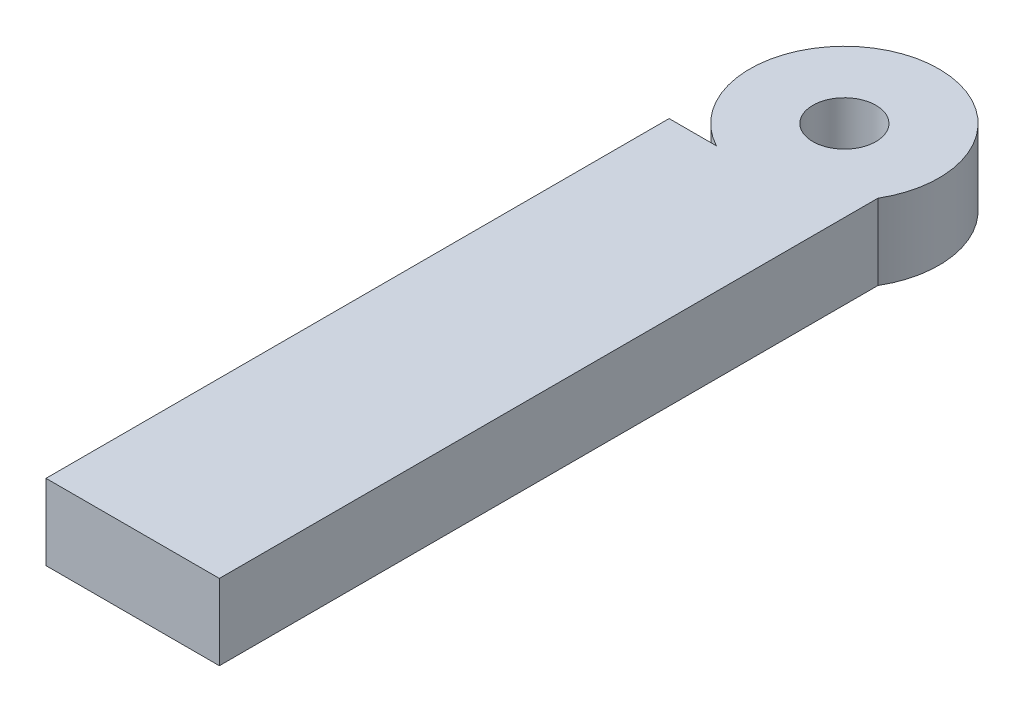
from build123d import *

# Parameters (mm, degrees)
SKETCH1_R           = 3.175
BOSS_EXTRUDE1_DEPTH = 7.62
SKETCH2_R           = 2.54
CUT_EXTRUDE1_DEPTH  = 6.35
BOSS_EXTRUDE3_START = 4.7625
SKETCH4_W           = 62.764867648
SKETCH4_H           = 7.62
SKETCH4_R           = 2.54
BOSS_EXTRUDE3_DEPTH = 4.7625


with BuildPart() as part:
    # Sketch1 → Boss-Extrude1 (new body)
    with BuildSketch(Plane(origin=(0, 0, 0), x_dir=(1, 0, 0), z_dir=(0, 1, 0))):
        with BuildLine():
            Line((-4.490128061, -8.400260413), (-4.490128061, -71.165128061))
            Line((-4.490128061, -71.165128061), (8.209871939, -71.165128061))
            Line((8.209871939, -71.165128061), (8.209871939, -4.829454186))
            ThreePointArc((8.209871939, -4.829454186), (-2.578136518, 9.169451297), (-4.490128061, -8.400260413))
        make_face()
        Circle(SKETCH1_R, mode=Mode.SUBTRACT)
    extrude(amount=BOSS_EXTRUDE1_DEPTH)

    # Sketch2 → Cut-Extrude1 (cut)
    with BuildSketch(Plane.ZY.offset(4.490128061)):
        with Locations((14.750260413, 3.81)):
            Circle(SKETCH2_R)
        with Locations((52.850260413, 3.81)):
            Circle(SKETCH2_R)
    extrude(amount=-CUT_EXTRUDE1_DEPTH, mode=Mode.SUBTRACT)

    # Sketch4 → Boss-Extrude3 (add)
    with BuildSketch(Plane.ZY.offset(4.490128061).offset(BOSS_EXTRUDE3_START)):
        with Locations((39.782694237, 3.81)):
            Rectangle(SKETCH4_W, SKETCH4_H)
        with Locations((52.850260413, 3.81)):
            Circle(SKETCH4_R, mode=Mode.SUBTRACT)
        with Locations((14.750260413, 3.81)):
            Circle(SKETCH4_R, mode=Mode.SUBTRACT)
    extrude(amount=-BOSS_EXTRUDE3_DEPTH)


solid = part.part
